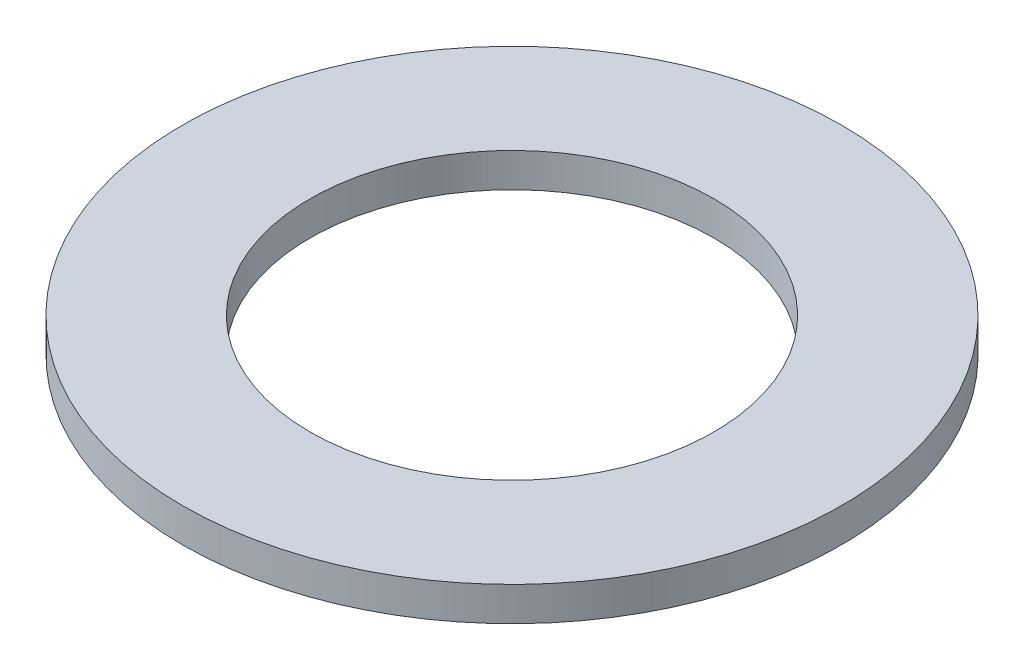
from build123d import *

# Parameters (mm, degrees)
SKETCH1_R           = 77.5
BOSS_EXTRUDE1_DEPTH = 8
SKETCH2_R           = 47.5
CUT_EXTRUDE1_DEPTH  = 110.893129904


with BuildPart() as part:
    # Sketch1 → Boss-Extrude1 (new body)
    with BuildSketch(Plane(origin=(0, 0, 0), x_dir=(1, 0, 0), z_dir=(0, 1, 0))):
        Circle(SKETCH1_R)
    extrude(amount=BOSS_EXTRUDE1_DEPTH)

    # Sketch2 → Cut-Extrude1 (cut, through all)
    with BuildSketch(Plane(origin=(0, 0, 0), x_dir=(1, 0, 0), z_dir=(0, 1, 0))):
        Circle(SKETCH2_R)
    extrude(amount=CUT_EXTRUDE1_DEPTH, mode=Mode.SUBTRACT)


solid = part.part
